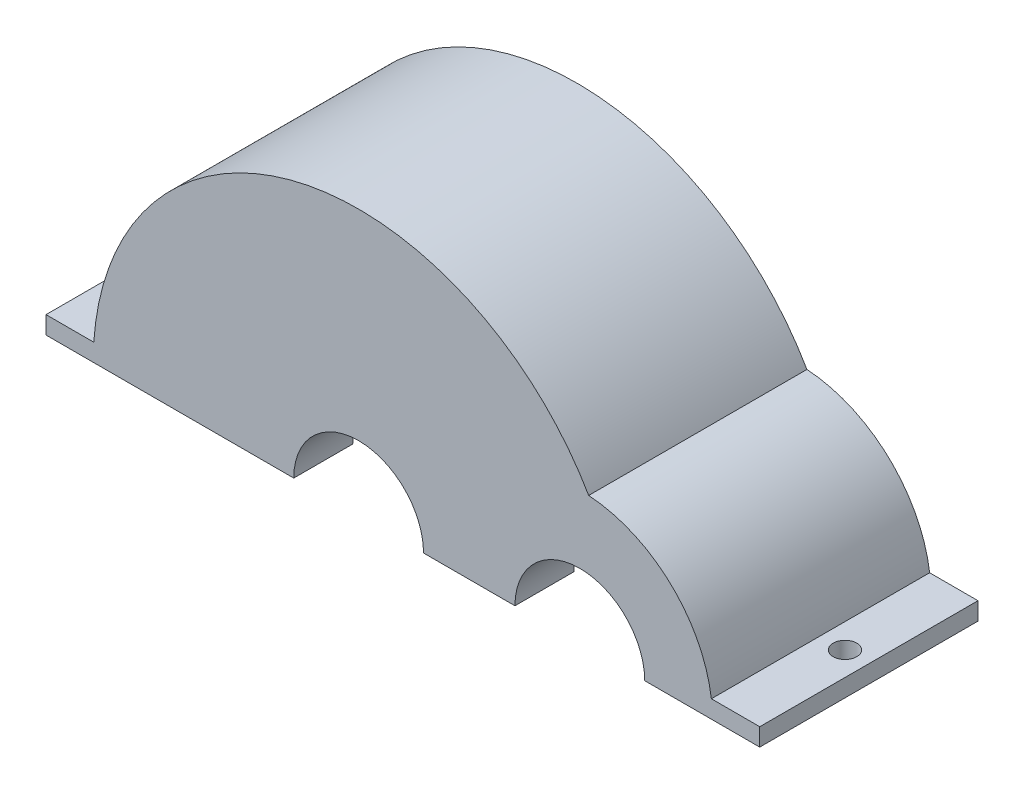
from build123d import *

# Parameters (mm, degrees)
BOSS_EXTRUDE2_DEPTH      = 27
SHELL5_DEPTH             = 17
BOSS_EXTRUDE3_START      = 10
BOSS_EXTRUDE3_DEPTH      = 10
SKETCH5_R                = 11
CUT_EXTRUDE2_DEPTH       = 87.360074687
BOSS_EXTRUDE4_DEPTH      = 37
BOSS_EXTRUDE5_DEPTH      = 3
BOSS_EXTRUDE5_DEPTH_BACK = 50
SKETCH10_R               = 2
CUT_EXTRUDE3_DEPTH       = 10
SKETCH11_W               = 121
SKETCH11_H               = 37
CUT_EXTRUDE4_DEPTH       = 92.526294036


# Read off the part's stored shape, not the designer's step: Shell5
with BuildPart() as part:
    # Sketch1 → Boss-Extrude2 (new body)
    with BuildSketch(Plane.XY):
        with BuildLine():
            ThreePointArc((20.25, 22.449944321), (-63.75, 0), (20.25, -22.449944321))
            ThreePointArc((20.25, -22.449944321), (41.25, 0), (20.25, 22.449944321))
        make_face()
    extrude(amount=BOSS_EXTRUDE2_DEPTH)

    # Shell5 outline → Shell5 (cut)
    with BuildSketch(Plane.XY):
        with BuildLine():
            ThreePointArc((14.25, -11.66190379), (31.25, 0), (14.25, 11.66190379))
            ThreePointArc((14.25, 11.66190379), (-53.75, 0), (14.25, -11.66190379))
        make_face()
    extrude(amount=SHELL5_DEPTH, mode=Mode.SUBTRACT)

    # Sketch4 → Boss-Extrude3 (add)
    with BuildSketch(Plane(origin=(0, 0, 0), x_dir=(-1, 0, 0), z_dir=(0, 0, -1)).offset(BOSS_EXTRUDE3_START)):
        with BuildLine():
            ThreePointArc((-20.25, 22.449944321), (-41.25, 0), (-20.25, -22.449944321))
            ThreePointArc((-20.25, -22.449944321), (63.75, 0), (-20.25, 22.449944321))
        make_face()
    extrude(amount=-BOSS_EXTRUDE3_DEPTH)

    # Sketch5 → Cut-Extrude2 (cut, through all)
    with BuildSketch(Plane(origin=(0, 0, -10), x_dir=(-1, 0, 0), z_dir=(0, 0, -1))):
        with Locations((-18.75, 0)):
            Circle(SKETCH5_R)
        with Locations((18.75, 0)):
            Circle(SKETCH5_R)
    extrude(amount=-CUT_EXTRUDE2_DEPTH, mode=Mode.SUBTRACT)

    # Sketch8 → Boss-Extrude4 (add)
    with BuildSketch(Plane(origin=(0, 0, -10), x_dir=(-1, 0, 0), z_dir=(0, 0, -1))):
        with BuildLine():
            Line((-41.25, 0), (-41.25, -50))
            Line((-41.25, -50), (63.75, -50))
            Line((63.75, -50), (63.75, 0))
            ThreePointArc((63.75, 0), (30.368950039, -43.474130239), (-20.25, -22.449944321))
            ThreePointArc((-20.25, -22.449944321), (-35.181676725, -15.370426149), (-41.25, 0))
        make_face()
    extrude(amount=-BOSS_EXTRUDE4_DEPTH)

    # Sketch9 → Boss-Extrude5 (add, two sides: drawn at the far end of the back side and taken through both)
    with BuildSketch(Plane(origin=(0, 0, 0), x_dir=(1, 0, 0), z_dir=(0, 1, 0)).offset(-BOSS_EXTRUDE5_DEPTH_BACK)):
        Polygon((-71.75, -27), (-58.75, -27), (-58.75, -8.5), (-58.75, 10), (-71.75, 10), align=None)
        Polygon((36.25, -8.5), (36.25, 10), (49.25, 10), (49.25, -27), (36.25, -27), align=None)
    extrude(amount=BOSS_EXTRUDE5_DEPTH + BOSS_EXTRUDE5_DEPTH_BACK)

    # Sketch10 → Cut-Extrude3 (cut)
    with BuildSketch(Plane(origin=(0, 3, 0), x_dir=(1, 0, 0), z_dir=(0, 1, 0))):
        with Locations(Location((-67.699944321, -8.5, 0), (0, 0, 270))):
            Circle(SKETCH10_R)
        with Locations(Location((45.199944321, -8.5, 0), (0, 0, 90))):
            Circle(SKETCH10_R)
    extrude(amount=-CUT_EXTRUDE3_DEPTH, mode=Mode.SUBTRACT)

    # Sketch11 → Cut-Extrude4 (cut, through all)
    with BuildSketch(Plane(origin=(0, 0, 0), x_dir=(1, 0, 0), z_dir=(0, 1, 0))):
        with Locations((-11.25, -8.5)):
            Rectangle(SKETCH11_W, SKETCH11_H)
    extrude(amount=-CUT_EXTRUDE4_DEPTH, mode=Mode.SUBTRACT)


solid = part.part
